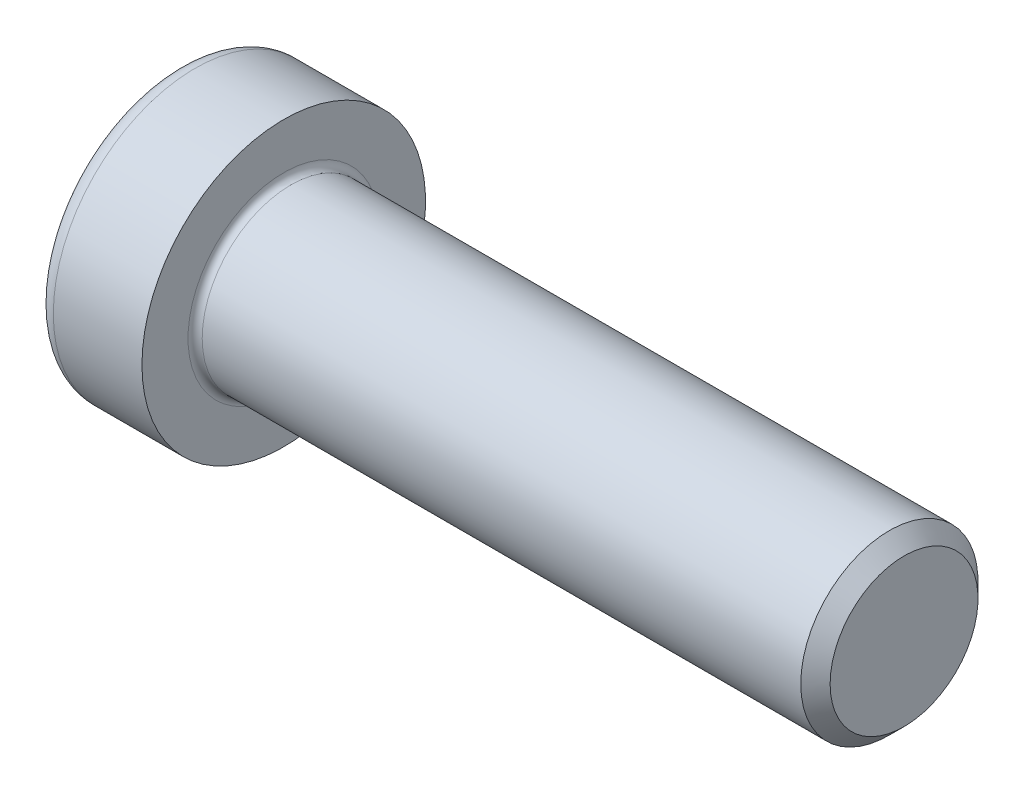
from build123d import *

# Parameters (mm, degrees)
FILLET1_R   = 0.4
FILLET2_R   = 1
HEX_2_DEPTH = 4.5


with BuildPart() as part:
    # BodySke → Base-Revolve (revolve)
    with BuildSketch(Plane.XY):
        Polygon((0, 0), (0, 8), (6, 8), (6, 5), (40.172, 5), (41, 4.172), (41, 0), align=None)
    revolve(axis=Axis((-31.75, 0, 0), (1, 0, 0)))

    # Fillet1
    fillet1_edges = [part.edges().sort_by_distance(p)[0] for p in [
        (6, -5, 0),
    ]]
    fillet(fillet1_edges, radius=FILLET1_R)

    # Fillet2
    fillet2_edges = [part.edges().sort_by_distance(p)[0] for p in [
        (0, -8, 0),
    ]]
    fillet(fillet2_edges, radius=FILLET2_R)

    # Sketch2 → Hex-PreBroach (revolve, cut)
    with BuildSketch(Plane.XY):
        Polygon((0, 3.5), (4.5, 3.5), (6.520725942, 0), (0, 0), align=None)
    revolve(axis=Axis((0, 0, 0), (1, 0, 0)), mode=Mode.SUBTRACT)

    # Sketch3 → Hex 2 (cut)
    with BuildSketch(Plane(origin=(0, 0, 0), x_dir=(0, 0.500000000000001, 0.866025403784438), z_dir=(-1, 0, 0))):
        Polygon((2.020725942, 3.5), (-2.020725942, 3.5), (-4.041451884, 0), (-2.020725942, -3.5), (2.020725942, -3.5), (4.041451884, 0), align=None)
    extrude(amount=-HEX_2_DEPTH, mode=Mode.SUBTRACT)


solid = part.part
